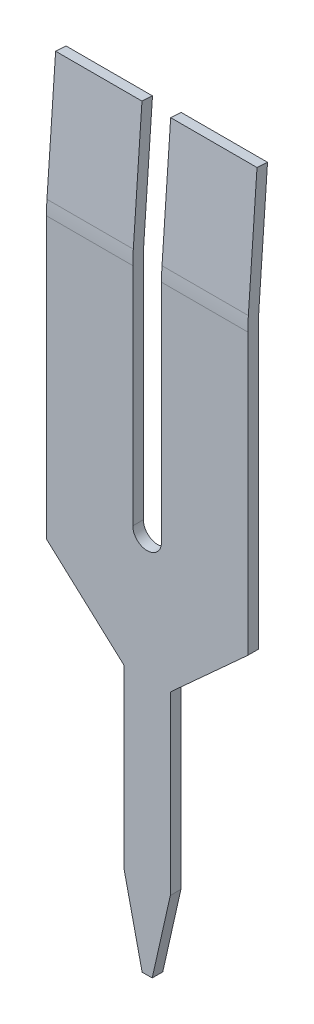
from build123d import *

# Parameters (mm, degrees)
BOSS_EXTRUDE1_DEPTH  = 0.21
SKETCH2_W            = 4
SKETCH2_H            = 0.21
CUT_EXTRUDE1_DEPTH   = 2.6
SWEEP1_START         = 0.285
SWEEP1_DEPTH         = 1.715
FILLET1_START        = -3
FILLET1_DEPTH        = 6
FILLET1_START_2      = -2
FILLET1_2_DEPTH      = 1.715
FILLET1_START_3      = 0.285
FILLET1_3_DEPTH      = 1.715
SKETCH4_R            = 0.25
CUT_EXTRUDE2_DEPTH   = 0.15
FILLET2_R            = 0.25
FILLET3_R            = 0.2
FILLET2_OF_MIRROR4_R = 0.25
FILLET3_OF_MIRROR4_R = 0.2
SKETCH6_W            = 4
SKETCH6_H            = 0.209488451
CUT_EXTRUDE5_DEPTH   = 15.914789915


with BuildPart() as part:
    # Sketch1 → Boss-Extrude1 (new body)
    with BuildSketch(Plane.XY):
        with BuildLine():
            Line((-0.285, 7.215), (-2, 7.215))
            Line((-2, 7.215), (-2, -1.085))
            Line((-2, -1.085), (-0.46, -2.485))
            Line((-0.46, -2.485), (-0.46, -5.985))
            Line((-0.46, -5.985), (-0.1, -7.585))
            Line((-0.1, -7.585), (0.1, -7.585))
            Line((0.1, -7.585), (0.46, -5.985))
            Line((0.46, -5.985), (0.46, -2.485))
            Line((0.46, -2.485), (2, -1.085))
            Line((2, -1.085), (2, 7.215))
            Line((2, 7.215), (0.285, 7.215))
            Line((0.285, 7.215), (0.285, 0))
            ThreePointArc((0.285, 0), (0, -0.285), (-0.285, 0))
            Line((-0.285, 0), (-0.285, 7.215))
        make_face()
    extrude(amount=BOSS_EXTRUDE1_DEPTH)

    # Sketch2 → Cut-Extrude1 (cut)
    with BuildSketch(Plane(origin=(0, 7.215, 0), x_dir=(1, 0, 0), z_dir=(0, 1, 0))):
        with Locations((0, -0.105)):
            Rectangle(SKETCH2_W, SKETCH2_H)
    extrude(amount=-CUT_EXTRUDE1_DEPTH, mode=Mode.SUBTRACT)

    # Sweep1: read off the stored shape, not the designer's step
    # Sweep1 outline → Sweep1 (add)
    with BuildSketch(Plane.YZ.offset(SWEEP1_START)):
        Polygon((4.615, 0), (7.215, -0.181809711), (7.215, 0.028190289), (4.615, 0.21), align=None)
    extrude(amount=SWEEP1_DEPTH)

    # Mirror3: part across plane


with BuildPart() as part_1:
    add(part.part)
    add(part.part.mirror(Plane(origin=(0, 0, 0), x_dir=(0, 0, 1), z_dir=(1, 0, 0))))

    # Fillet1: read off the stored shape, not the designer's step
    # Fillet1 outline → Fillet1 (cut)
    with BuildSketch(Plane.YZ.offset(FILLET1_START)):
        with BuildLine():
            ThreePointArc((4.475316922, 0.21), (4.614914909, 0.207563308), (4.754342817, 0.200256201))
            Line((4.754342817, 0.200256201), (4.615, 0.21))
            Line((4.615, 0.21), (4.475316922, 0.21))
        make_face()
    extrude(amount=FILLET1_DEPTH, mode=Mode.SUBTRACT)

    # Fillet1 2 outline → Fillet1 2 (add)
    with BuildSketch(Plane.YZ.offset(FILLET1_START_2)):
        with BuildLine():
            Line((4.615, 0), (4.475316922, 0))
            ThreePointArc((4.475316922, 0), (4.614914909, -0.002436692), (4.754342817, -0.009743799))
            Line((4.754342817, -0.009743799), (4.615, 0))
        make_face()
    extrude(amount=FILLET1_2_DEPTH)

    # Fillet1 3 outline → Fillet1 3 (add)
    with BuildSketch(Plane.YZ.offset(FILLET1_START_3)):
        with BuildLine():
            Line((4.615, 0), (4.475316922, 0))
            ThreePointArc((4.475316922, 0), (4.614914909, -0.002436692), (4.754342817, -0.009743799))
            Line((4.754342817, -0.009743799), (4.615, 0))
        make_face()
    extrude(amount=FILLET1_3_DEPTH)

    # Sketch4 → Cut-Extrude2 (cut)
    with BuildSketch(Plane(origin=(0, 0.022456431, 0.32114193), x_dir=(-1, 0, 0), z_dir=(0, -0.06975647374412543, -0.9975640502598243))):
        with Locations(Location((-1.1425, 6.260107027, 0), (0, 0, 90))):
            Circle(SKETCH4_R)
        with Locations(Location((-1.1425, 5.260107027, 0), (0, 0, 90))):
            Circle(SKETCH4_R)
    cut_extrude2 = extrude(amount=-CUT_EXTRUDE2_DEPTH, mode=Mode.SUBTRACT)

    # Fillet2
    # the kernel refuses this fillet: 0.25 mm, written as the material it adds along each edge
    with BuildSketch(Plane(origin=(1.1425, 6.277777623, 0.034093547), x_dir=(0, 0.9975640502598242, -0.06975647374412533), z_dir=(-1, 0, 0))) as fillet2_piece_1:
        with BuildLine():
            CenterArc((0.020871215, 0.25), FILLET2_R, 270, 66.421821522)
            Line((0.020871215, 0), (0.020871215, -0.005))
            Line((0.020871215, -0.005), (0.25, -0.005))
            Line((0.25, -0.005), (0.255, 0))
            ThreePointArc((0.255, 0), (0.255, 0.075), (0.254582576, 0.148))
            Line((0.254582576, 0.148), (0.25, 0.15))
        make_face()
    revolve(axis=Axis((1.1425, 6.277777623, 0.034093547), (0, -0.06975647374412543, -0.9975640502598243)))
    with BuildSketch(Plane(origin=(1.1425, 5.280213573, 0.10385002), x_dir=(0, 0.9975640502598242, -0.06975647374412533), z_dir=(-1, 0, 0))) as fillet2_piece_2:
        with BuildLine():
            CenterArc((0.020871215, 0.25), FILLET2_R, 270, 66.421821522)
            Line((0.020871215, 0), (0.020871215, -0.005))
            Line((0.020871215, -0.005), (0.25, -0.005))
            Line((0.25, -0.005), (0.255, 0))
            ThreePointArc((0.255, 0), (0.255, 0.075), (0.254582576, 0.148))
            Line((0.254582576, 0.148), (0.25, 0.15))
        make_face()
    revolve(axis=Axis((1.1425, 5.280213573, 0.10385002), (0, -0.06975647374412543, -0.9975640502598243)))

    # Fillet3
    fillet3_edges = [part_1.edges().sort_by_distance(p)[0] for p in [
        (1.1425, 6.01792314, -0.098101943),
        (1.1425, 5.020359089, -0.028345469),
    ]]
    fillet(fillet3_edges, radius=FILLET3_R)

    # Mirror4: Cut-Extrude2 across plane
    add(cut_extrude2.mirror(Plane(origin=(0, 0, 0), x_dir=(0, 0, 1), z_dir=(1, 0, 0))), mode=Mode.SUBTRACT)

    # Fillet2 of Mirror4
    # the kernel refuses this fillet: 0.25 mm, written as the material it adds along each edge
    with BuildSketch(Plane(origin=(-1.1425, 6.277777623, 0.034093547), x_dir=(0, 0.9975640502598242, -0.06975647374412533), z_dir=(1, 0, 0))) as fillet2_of_mirror4_piece_1:
        with BuildLine():
            CenterArc((0.020871215, -0.25), FILLET2_OF_MIRROR4_R, 23.578178478, 66.421821522)
            Line((0.020871215, 0), (0.020871215, 0.005))
            Line((0.020871215, 0.005), (0.25, 0.005))
            Line((0.25, 0.005), (0.255, 0))
            ThreePointArc((0.255, 0), (0.255, -0.075), (0.254582576, -0.148))
            Line((0.254582576, -0.148), (0.25, -0.15))
        make_face()
    revolve(axis=Axis((-1.1425, 6.277777623, 0.034093547), (0, 0.06975647374412543, 0.9975640502598243)))
    with BuildSketch(Plane(origin=(-1.1425, 5.280213573, 0.10385002), x_dir=(0, 0.9975640502598242, -0.06975647374412533), z_dir=(1, 0, 0))) as fillet2_of_mirror4_piece_2:
        with BuildLine():
            CenterArc((0.020871215, -0.25), FILLET2_OF_MIRROR4_R, 23.578178478, 66.421821522)
            Line((0.020871215, 0), (0.020871215, 0.005))
            Line((0.020871215, 0.005), (0.25, 0.005))
            Line((0.25, 0.005), (0.255, 0))
            ThreePointArc((0.255, 0), (0.255, -0.075), (0.254582576, -0.148))
            Line((0.254582576, -0.148), (0.25, -0.15))
        make_face()
    revolve(axis=Axis((-1.1425, 5.280213573, 0.10385002), (0, 0.06975647374412543, 0.9975640502598243)))

    # Fillet3 of Mirror4
    fillet3_of_mirror4_edges = [part_1.edges().sort_by_distance(p)[0] for p in [
        (-1.1425, 6.01792314, -0.098101943),
        (-1.1425, 5.020359089, -0.028345469),
    ]]
    fillet(fillet3_of_mirror4_edges, radius=FILLET3_OF_MIRROR4_R)

    # Sketch6 → Cut-Extrude5 (cut, through all)
    with BuildSketch(Plane(origin=(0, 7.177930393, -0.501929789), x_dir=(1, 0, 0), z_dir=(-1.513554906801369e-15, -0.9975640502598243, 0.06975647374412539))):
        with Locations((0, 0.426670352)):
            Rectangle(SKETCH6_W, SKETCH6_H)
    extrude(amount=-CUT_EXTRUDE5_DEPTH, mode=Mode.SUBTRACT)


solid = part_1.part
